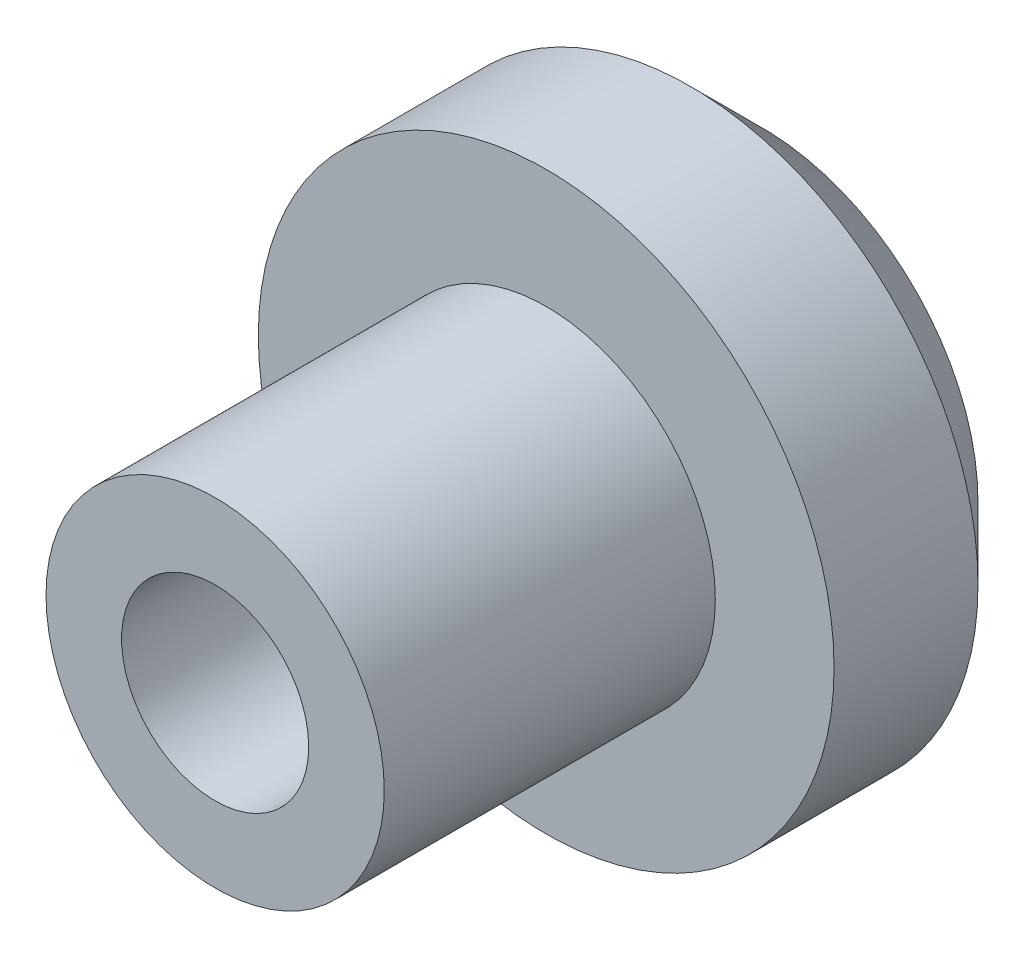
from build123d import *

# Parameters (mm, degrees)
SKETCH1_R           = 4
BOSS_EXTRUDE1_DEPTH = 3
SKETCH2_R           = 2.35
BOSS_EXTRUDE2_DEPTH = 4.6
SKETCH3_R           = 1.3
CUT_EXTRUDE1_DEPTH  = 10.474175426
CHAMFER1_SIZE       = 1


with BuildPart() as part:
    # Sketch1 → Boss-Extrude1 (new body)
    with BuildSketch(Plane.XY):
        Circle(SKETCH1_R)
    extrude(amount=BOSS_EXTRUDE1_DEPTH)

    # Sketch2 → Boss-Extrude2 (add)
    with BuildSketch(Plane.XY.offset(3)):
        Circle(SKETCH2_R)
    extrude(amount=BOSS_EXTRUDE2_DEPTH)

    # Sketch3 → Cut-Extrude1 (cut, through all)
    with BuildSketch(Plane.XY.offset(7.6)):
        Circle(SKETCH3_R)
    extrude(amount=-CUT_EXTRUDE1_DEPTH, mode=Mode.SUBTRACT)

    # Chamfer1
    chamfer1_edges = [part.edges().sort_by_distance(p)[0] for p in [
        (-4, 0, 0),
    ]]
    chamfer(chamfer1_edges, length=CHAMFER1_SIZE)


solid = part.part
